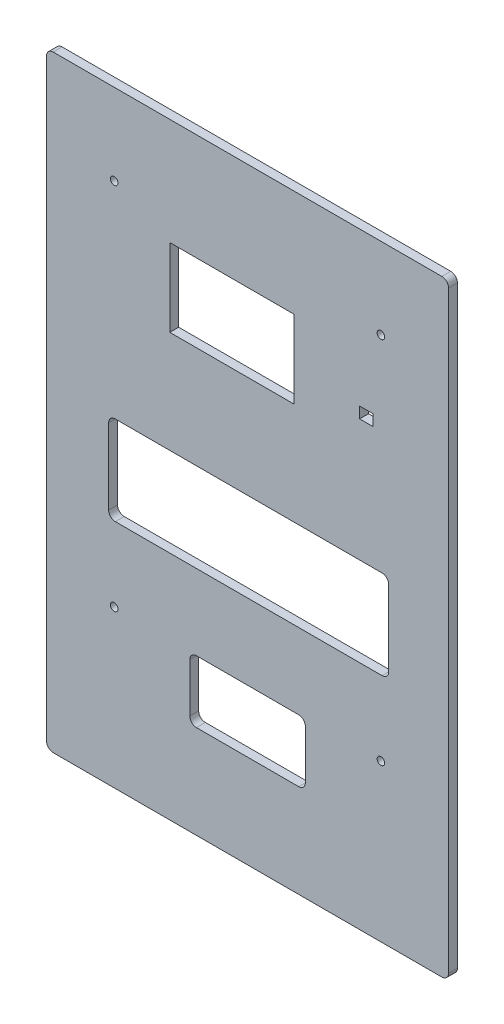
from build123d import *

# Parameters (mm, degrees)
ESQUISSE1_W        = 180.86
ESQUISSE1_H        = 273
ESQUISSE1_R        = 1.5
ESQUISSE1_W_2      = 52
ESQUISSE1_H_2      = 28
ESQUISSE1_W_3      = 126
ESQUISSE1_H_3      = 40
ESQUISSE1_W_4      = 56
ESQUISSE1_H_4      = 35
ESQUISSE1_W_5      = 6
ESQUISSE1_H_5      = 5
BOSS_EXTRU_1_DEPTH = 4
D_GAGEMENT_M31_D   = 3.4
CONG_1_R           = 3


with BuildPart() as part:
    # Esquisse1 → Boss.-Extru.1 (new body)
    with BuildSketch(Plane.XY):
        with Locations((90.43, 136.5)):
            Rectangle(ESQUISSE1_W, ESQUISSE1_H)
        with Locations((30.43, 236.5)):
            Circle(ESQUISSE1_R, mode=Mode.SUBTRACT)
        with Locations((150.43, 236.5)):
            Circle(ESQUISSE1_R, mode=Mode.SUBTRACT)
        with Locations((30.43, 70.5)):
            Circle(ESQUISSE1_R, mode=Mode.SUBTRACT)
        with Locations((150.43, 70.5)):
            Circle(ESQUISSE1_R, mode=Mode.SUBTRACT)
        with Locations((90.43, 56)):
            Rectangle(ESQUISSE1_W_2, ESQUISSE1_H_2, mode=Mode.SUBTRACT)
        with Locations((90.93, 124)):
            Rectangle(ESQUISSE1_W_3, ESQUISSE1_H_3, mode=Mode.SUBTRACT)
        with Locations((83.43, 207.5)):
            Rectangle(ESQUISSE1_W_4, ESQUISSE1_H_4, mode=Mode.SUBTRACT)
        with Locations((143.86, 201.5)):
            Rectangle(ESQUISSE1_W_5, ESQUISSE1_H_5, mode=Mode.SUBTRACT)
    extrude(amount=BOSS_EXTRU_1_DEPTH)

    # Dégagement M31 (through all)
    with Locations(Plane.XY.offset(4)):
        with Locations((30.43, 236.5), (150.43, 236.5), (150.43, 70.5), (30.43, 70.5)):
            Hole(D_GAGEMENT_M31_D / 2)

    # Congé1
    cong_1_edges = [part.edges().sort_by_distance(p)[0] for p in [
        (0, 0, 2),
        (180.86, 0, 2),
        (116.43, 42, 2),
        (64.43, 42, 2),
        (116.43, 70, 2),
        (64.43, 70, 2),
        (153.93, 104, 2),
        (27.93, 104, 2),
        (153.93, 144, 2),
        (27.93, 144, 2),
        (180.86, 273, 2),
        (0, 273, 2),
    ]]
    fillet(cong_1_edges, radius=CONG_1_R)


solid = part.part
